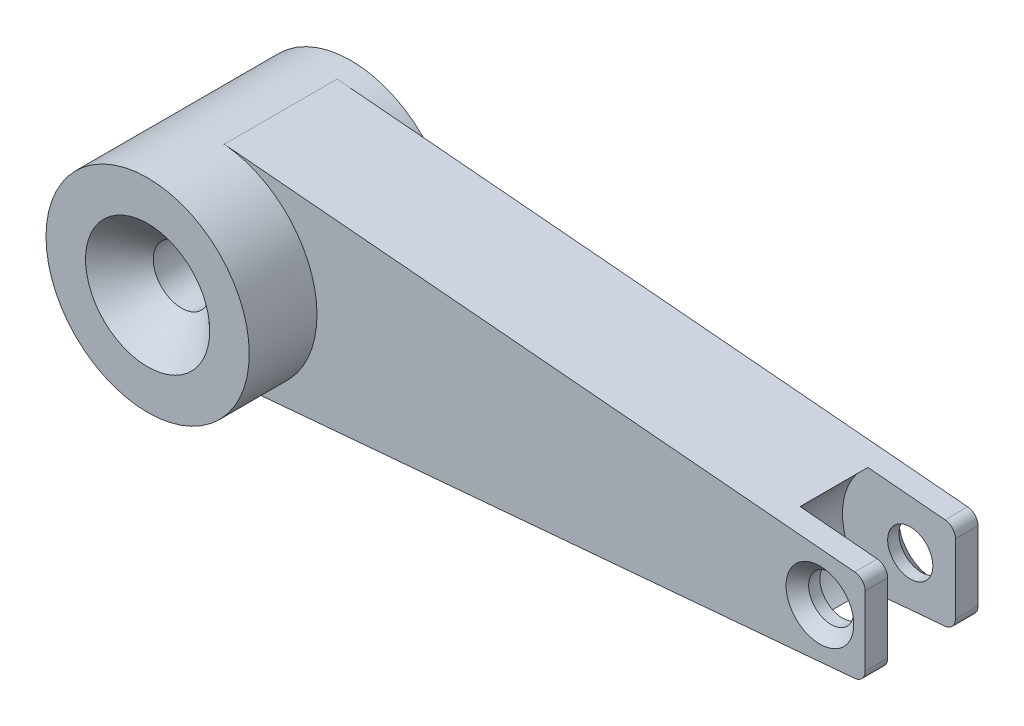
from build123d import *

# Parameters (mm, degrees)
IZIM1_R                     = 9
Y_KSEKLIK_EKSTR_ZYON1_DEPTH = 18
Y_KSEKLIK_EKSTR_ZYON2_DEPTH = 12
KES_EKSTR_ZYON1_DEPTH       = 2
IZIM5_R                     = 2.5
KES_EKSTR_ZYON2_DEPTH       = 29
KES_EKSTR_ZYON3_DEPTH       = 3
KES_EKSTR_ZYON3_DEPTH_BACK  = 3
IZIM6_R                     = 6
PAH1_SIZE                   = 3
RADYUS1_R                   = 1
IZIM7_R                     = 2
KES_EKSTR_ZYON4_DEPTH       = 13
PAH2_SIZE                   = 1


with BuildPart() as part:
    # Çizim1 → Yükseklik-Ekstrüzyon1 (new body)
    with BuildSketch(Plane.XY):
        Circle(IZIM1_R)
    extrude(amount=Y_KSEKLIK_EKSTR_ZYON1_DEPTH)

    # Çizim2 → Yükseklik-Ekstrüzyon2 (add)
    with BuildSketch(Plane.XY):
        Polygon((0.784401685, 8.965752283), (57.54321, 4), (57.54321, -4), (0.784401685, -8.965752283), align=None)
    extrude(amount=Y_KSEKLIK_EKSTR_ZYON2_DEPTH)

    # Çizim4 → Kes-Ekstrüzyon1 (cut)
    with BuildSketch(Plane(origin=(0, 0, 0), x_dir=(-1, 0, 0), z_dir=(0, 0, -1))):
        with BuildLine():
            Line((-0.784401685, 8.965752283), (-57.54321, 4))
            Line((-57.54321, 4), (-57.54321, -4))
            Line((-57.54321, -4), (-0.784401685, -8.965752283))
            ThreePointArc((-0.784401685, -8.965752283), (-9, 0), (-0.784401685, 8.965752283))
        make_face()
    extrude(amount=-KES_EKSTR_ZYON1_DEPTH, mode=Mode.SUBTRACT)

    # Çizim5 → Kes-Ekstrüzyon2 (cut)
    with BuildSketch(Plane(origin=(0, 0, 0), x_dir=(-1, 0, 0), z_dir=(0, 0, -1))):
        Circle(IZIM5_R)
    extrude(amount=-KES_EKSTR_ZYON2_DEPTH, mode=Mode.SUBTRACT)

    # Çizim6 → Kes-Ekstrüzyon3 (cut, two sides: drawn at the far end of the back side and taken through both)
    with BuildSketch(Plane.XY.offset(7).offset(-KES_EKSTR_ZYON3_DEPTH_BACK)):
        with Locations((53.54321, 0)):
            Circle(IZIM6_R)
    extrude(amount=KES_EKSTR_ZYON3_DEPTH + KES_EKSTR_ZYON3_DEPTH_BACK, mode=Mode.SUBTRACT)

    # Pah1
    pah1_edges = [part.edges().sort_by_distance(p)[0] for p in [
        (2.5, 0, 0),
        (2.5, 0, 18),
    ]]
    chamfer(pah1_edges, length=PAH1_SIZE)

    # Radyus1
    radyus1_edges = [part.edges().sort_by_distance(p)[0] for p in [
        (57.54321, -4, 3),
        (57.54321, 4, 3),
        (57.54321, -4, 11),
        (57.54321, 4, 11),
    ]]
    fillet(radyus1_edges, radius=RADYUS1_R)

    # Çizim7 → Kes-Ekstrüzyon4 (cut)
    with BuildSketch(Plane.XY.offset(12)):
        with Locations((53.54321, 0)):
            Circle(IZIM7_R)
    extrude(amount=-KES_EKSTR_ZYON4_DEPTH, mode=Mode.SUBTRACT)

    # Pah2
    pah2_edges = [part.edges().sort_by_distance(p)[0] for p in [
        (51.54321, 0, 2),
        (51.54321, 0, 12),
    ]]
    chamfer(pah2_edges, length=PAH2_SIZE)


solid = part.part
